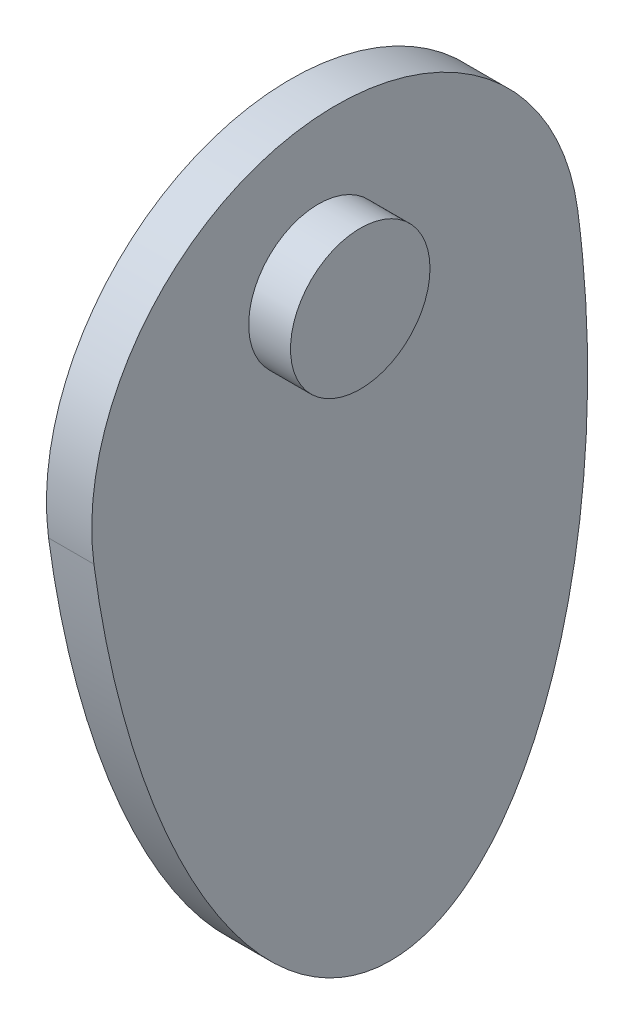
from build123d import *

# Parameters (mm, degrees)
RESSALTO_EXTRUS_O11_DEPTH = 13
ESBO_O44_R                = 20
RESSALTO_EXTRUS_O12_DEPTH = 12


with BuildPart() as part:
    # Esboço43 → Ressalto-extrusão11 (new body)
    with BuildSketch(Plane(origin=(0, 0, 0), x_dir=(0, 0, -1), z_dir=(1, 0, 0))):
        with BuildLine():
            ThreePointArc((69.385953048, 9.251460406), (-9.251460406, 69.385953048), (-69.385953048, -9.251460406))
            add(Edge.make_bspline(
                [(-69.385953048, -9.251460406), (-49.385953048, -159.251460406), (20, -150), (89.385953048, -140.748539594), (69.385953048, 9.251460406)],
                knots=[4.71238898, 4.71238898, 4.71238898, 6.283185307, 6.283185307, 7.853981634, 7.853981634, 7.853981634], degree=2, weights=[1, 0.707106781, 1, 0.707106781, 1]))
        make_face()
    extrude(amount=RESSALTO_EXTRUS_O11_DEPTH)

    # Esboço44 → Ressalto-extrusão12 (add)
    with BuildSketch(Plane(origin=(0, 0, 0), x_dir=(0, 0, -1), z_dir=(1, 0, 0))):
        with Locations((-5, 28.000002978)):
            Circle(ESBO_O44_R)
    extrude(amount=-RESSALTO_EXTRUS_O12_DEPTH)


with BuildPart() as body_2:
    # Espelhar3: mirrored copy
    add(part.part.mirror(Plane(origin=(-50, 0, 0), x_dir=(0, 0, 1), z_dir=(1, 0, 0))))


solid = body_2.part
